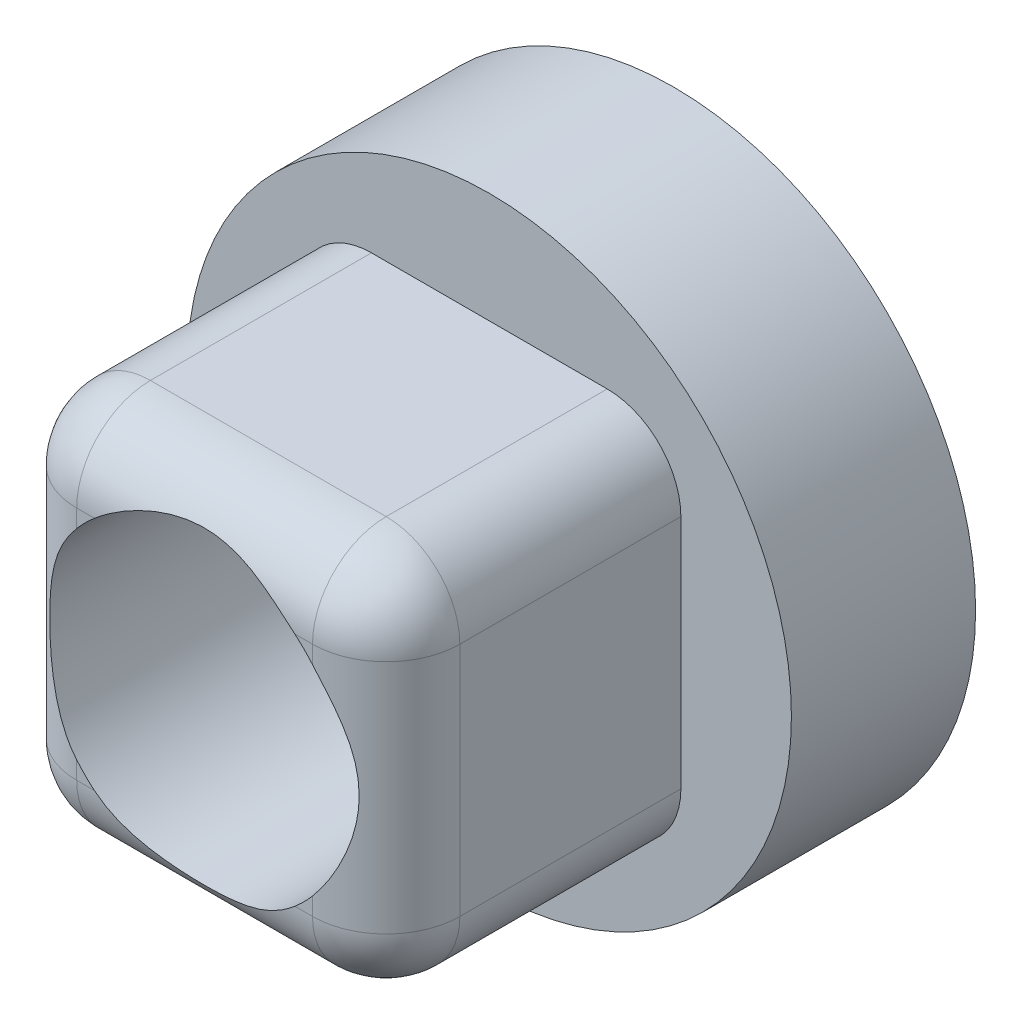
from build123d import *

# Parameters (mm, degrees)
SKETCH1_R           = 4.1
BOSS_EXTRUDE1_DEPTH = 2.5
SKETCH2_W           = 5.2
SKETCH2_H           = 5.2
BOSS_EXTRUDE2_DEPTH = 4
SKETCH3_R           = 2.1
CUT_EXTRUDE1_DEPTH  = 9.710338685
FILLET1_R           = 1


with BuildPart() as part:
    # Sketch1 → Boss-Extrude1 (new body)
    with BuildSketch(Plane(origin=(0, 0, 0), x_dir=(0, 1, 0), z_dir=(0, 0, 1))):
        with Locations(Location((0, 0, 0), (0, 0, 270))):
            Circle(SKETCH1_R)
    extrude(amount=BOSS_EXTRUDE1_DEPTH)

    # Sketch2 → Boss-Extrude2 (add)
    with BuildSketch(Plane.XY.offset(2.5)):
        Rectangle(SKETCH2_W, SKETCH2_H)
    extrude(amount=BOSS_EXTRUDE2_DEPTH)

    # Sketch3 → Cut-Extrude1 (cut, through all)
    with BuildSketch(Plane.XY.offset(6.5)):
        Circle(SKETCH3_R)
    extrude(amount=-CUT_EXTRUDE1_DEPTH, mode=Mode.SUBTRACT)

    # Fillet1
    # the kernel refuses this fillet: 1 mm, written as the material it takes off along each edge
    with BuildSketch(Plane(origin=(-1.6, -1.6, 5.5), x_dir=(0, -1, 0), z_dir=(0, 0, 1))) as fillet1_piece_1_section:
        Polygon((0, 0), (FILLET1_R, 0), (FILLET1_R, -FILLET1_R), (0, -FILLET1_R), align=None)
    fillet1_piece_1 = extrude(amount=FILLET1_R, mode=Mode.PRIVATE)
    fillet1_piece_1 = fillet1_piece_1 - Plane(origin=(-1.6, -1.6, 5.5), x_dir=(0.7071067811865475, 0.7071067811865475, 0), z_dir=(0, 0, 1)) * Sphere(FILLET1_R, mode=Mode.PRIVATE)
    add(fillet1_piece_1, mode=Mode.SUBTRACT)
    with BuildSketch(Plane(origin=(1.6, -1.6, 5.5), x_dir=(0, -1, 0), z_dir=(0, 0, 1))) as fillet1_piece_2_section:
        Polygon((0, 0), (FILLET1_R, 0), (FILLET1_R, FILLET1_R), (0, FILLET1_R), align=None)
    fillet1_piece_2 = extrude(amount=FILLET1_R, mode=Mode.PRIVATE)
    fillet1_piece_2 = fillet1_piece_2 - Plane(origin=(1.6, -1.6, 5.5), x_dir=(-0.7071067811865475, 0.7071067811865475, 0), z_dir=(0, 0, 1)) * Sphere(FILLET1_R, mode=Mode.PRIVATE)
    add(fillet1_piece_2, mode=Mode.SUBTRACT)
    with BuildSketch(Plane(origin=(1.6, 1.6, 5.5), x_dir=(1, 0, 0), z_dir=(0, 0, 1))) as fillet1_piece_3_section:
        Polygon((0, 0), (FILLET1_R, 0), (FILLET1_R, FILLET1_R), (0, FILLET1_R), align=None)
    fillet1_piece_3 = extrude(amount=FILLET1_R, mode=Mode.PRIVATE)
    fillet1_piece_3 = fillet1_piece_3 - Plane(origin=(1.6, 1.6, 5.5), x_dir=(-0.7071067811865475, -0.7071067811865475, 0), z_dir=(0, 0, 1)) * Sphere(FILLET1_R, mode=Mode.PRIVATE)
    add(fillet1_piece_3, mode=Mode.SUBTRACT)
    with BuildSketch(Plane(origin=(-1.6, 1.6, 5.5), x_dir=(0, 1, 0), z_dir=(0, 0, 1))) as fillet1_piece_4_section:
        Polygon((0, 0), (FILLET1_R, 0), (FILLET1_R, FILLET1_R), (0, FILLET1_R), align=None)
    fillet1_piece_4 = extrude(amount=FILLET1_R, mode=Mode.PRIVATE)
    fillet1_piece_4 = fillet1_piece_4 - Plane(origin=(-1.6, 1.6, 5.5), x_dir=(0.7071067811865475, -0.7071067811865475, 0), z_dir=(0, 0, 1)) * Sphere(FILLET1_R, mode=Mode.PRIVATE)
    add(fillet1_piece_4, mode=Mode.SUBTRACT)
    with BuildSketch(Plane(origin=(-1.6, -2.6, 6.5), x_dir=(0, 0, -1), z_dir=(1, 0, 0)), Plane(origin=(2.6, -1.6, 6.5), x_dir=(0, 0, -1), z_dir=(0, 1, 0)), Plane(origin=(1.6, 2.6, 6.5), x_dir=(0, 0, -1), z_dir=(-1, 0, 0)), Plane(origin=(-2.6, 1.6, 6.5), x_dir=(0, 0, -1), z_dir=(0, -1, 0))) as fillet1_piece_5:
        with BuildLine():
            CenterArc((FILLET1_R, FILLET1_R), FILLET1_R, 180, 90)
            Line((0, FILLET1_R), (0, 0))
            Line((0, 0), (FILLET1_R, 0))
        make_face()
    extrude(amount=3.2, mode=Mode.SUBTRACT)
    with BuildSketch(Plane(origin=(2.6, -2.6, 2.5), x_dir=(-1, 0, 0), z_dir=(0, 0, 1)), Plane(origin=(2.6, 2.6, 2.5), x_dir=(0, -1, 0), z_dir=(0, 0, 1)), Plane(origin=(-2.6, 2.6, 2.5), x_dir=(1, 0, 0), z_dir=(0, 0, 1))) as fillet1_piece_6:
        with BuildLine():
            CenterArc((FILLET1_R, -FILLET1_R), FILLET1_R, 90, 90)
            Line((0, -FILLET1_R), (0, 0))
            Line((0, 0), (FILLET1_R, 0))
        make_face()
    extrude(amount=3, mode=Mode.SUBTRACT)
    with BuildSketch(Plane(origin=(-2.6, -2.6, 2.5), x_dir=(1, 0, 0), z_dir=(0, 0, 1))) as fillet1_piece_7:
        with BuildLine():
            CenterArc((FILLET1_R, FILLET1_R), FILLET1_R, 180, 90)
            Line((0, FILLET1_R), (0, 0))
            Line((0, 0), (FILLET1_R, 0))
        make_face()
    extrude(amount=3, mode=Mode.SUBTRACT)


solid = part.part
